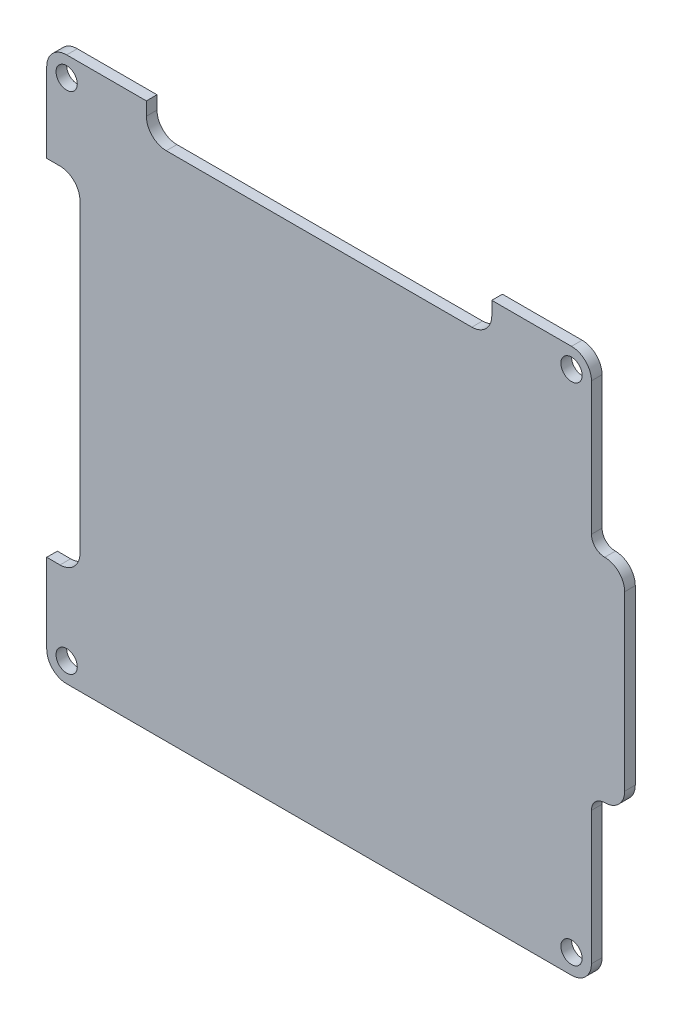
from build123d import *

# Parameters (mm, degrees)
BOSS_EXTRUDE1_DEPTH        = 1.6
F_3_2_3_2_DIAMETER_HOLE1_D = 3.2
FILLET1_R                  = 3
FILLET3_R                  = 2


with BuildPart() as part:
    # Sketch1 → Boss-Extrude1 (new body)
    with BuildSketch(Plane.XY):
        Polygon((-15.5, 86.75), (-15.5, 81.75), (-67.5, 81.75), (-67.5, 86.75), (-82.5, 86.75), (-82.5, 71.75), (-77.5, 71.75), (-77.5, 19.75), (-82.5, 19.75), (-82.5, 4.75), (-0.5, 4.75), (-0.5, 29.75), (4.5, 29.75), (4.5, 61.75), (-0.5, 61.75), (-0.5, 86.75), align=None)
    extrude(amount=-BOSS_EXTRUDE1_DEPTH)

    # Ø3.2 (3.2) Diameter Hole1 (through all)
    with Locations(Plane(origin=(0, 0, -1.6), x_dir=(-1, 0, 0), z_dir=(0, 0, -1))):
        with Locations((3.5, 83.75), (3.5, 7.75), (79.5, 7.75), (79.5, 83.75)):
            Hole(F_3_2_3_2_DIAMETER_HOLE1_D / 2)

    # Fillet1
    fillet1_edges = [part.edges().sort_by_distance(p)[0] for p in [
        (4.5, 61.75, -0.8),
        (4.5, 29.75, -0.8),
        (-0.5, 4.75, -0.8),
        (-82.5, 4.75, -0.8),
        (-77.5, 19.75, -0.8),
        (-77.5, 71.75, -0.8),
        (-82.5, 86.75, -0.8),
        (-67.5, 81.75, -0.8),
        (-15.5, 81.75, -0.8),
        (-0.5, 86.75, -0.8),
    ]]
    fillet(fillet1_edges, radius=FILLET1_R)

    # Fillet3
    fillet3_edges = [part.edges().sort_by_distance(p)[0] for p in [
        (-0.5, 29.75, -0.8),
        (-0.5, 61.75, -0.8),
    ]]
    fillet(fillet3_edges, radius=FILLET3_R - 0.0001)  # a hair under: the kernel refuses the full size


solid = part.part
